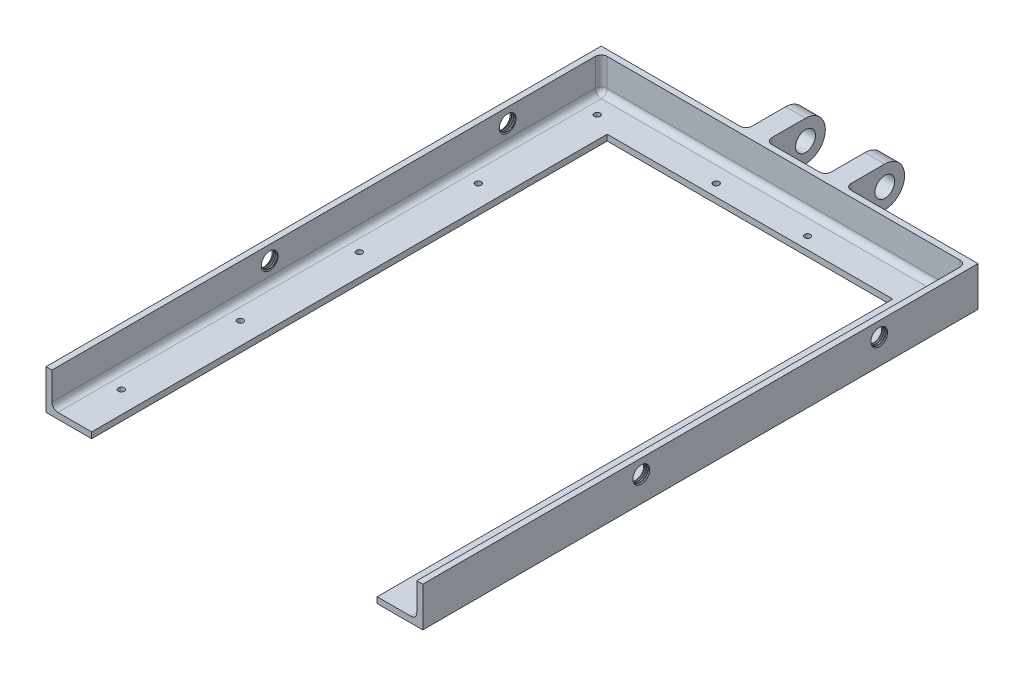
from build123d import *

# Parameters (mm, degrees)
SKETCH1_W               = 196
SKETCH1_H               = 20
BOSS_EXTRUDE1_DEPTH     = 3
SKETCH2_W               = 196
SKETCH2_H               = 3
BOSS_EXTRUDE2_DEPTH     = 17
FILLET1_R               = 3
SKETCH4_W               = 10
SKETCH4_H               = 20
BOSS_EXTRUDE3_DEPTH     = 30
FILLET2_R               = 10
CUT_EXTRUDE2_DEPTH      = 122.527774603
CUT_EXTRUDE2_DEPTH_BACK = 122.527774603
SKETCH5_R               = 5
BOSS_EXTRUDE4_START     = -17
BOSS_EXTRUDE4_DEPTH     = 277
BOSS_EXTRUDE5_START     = -17
BOSS_EXTRUDE5_DEPTH     = 277
SKETCH8_W               = 6
SKETCH8_H               = 26.142530345
CUT_EXTRUDE3_DEPTH      = 30
SKETCH9_R               = 1.5
CUT_EXTRUDE4_DEPTH      = 288.737727801
FILLET4_R               = 3
CUT_EXTRUDE5_REACH      = 332.757
SKETCH10_R              = 4
THREAD1_PITCH           = 1
THREAD2_PITCH           = 1
THREAD3_PITCH           = 1
THREAD4_PITCH           = 1
FILLET7_R               = 3


with BuildPart() as part:
    # Sketch1 → Boss-Extrude1 (new body)
    with BuildSketch(Plane(origin=(0, 0, 0), x_dir=(1, 0, 0), z_dir=(0, 1, 0))):
        Rectangle(SKETCH1_W, SKETCH1_H)
    extrude(amount=BOSS_EXTRUDE1_DEPTH)

    # Sketch2 → Boss-Extrude2 (add)
    with BuildSketch(Plane(origin=(0, 3, 0), x_dir=(1, 0, 0), z_dir=(0, 1, 0))):
        with Locations((0, 8.5)):
            Rectangle(SKETCH2_W, SKETCH2_H)
    extrude(amount=BOSS_EXTRUDE2_DEPTH)

    # Fillet1
    fillet1_edges = [part.edges().sort_by_distance(p)[0] for p in [
        (0, 3, -7),
    ]]
    fillet(fillet1_edges, radius=FILLET1_R)

    # Sketch4 → Boss-Extrude3 (add)
    with BuildSketch(Plane(origin=(0, 0, -10), x_dir=(-1, 0, 0), z_dir=(0, 0, -1))):
        with Locations((-20, 10)):
            Rectangle(SKETCH4_W, SKETCH4_H)
        with Locations((20, 10)):
            Rectangle(SKETCH4_W, SKETCH4_H)
    extrude(amount=BOSS_EXTRUDE3_DEPTH)

    # Fillet2
    fillet2_edges = [part.edges().sort_by_distance(p)[0] for p in [
        (-20, 0, -40),
        (-20, 20, -40),
        (20, 0, -40),
        (20, 20, -40),
    ]]
    fillet(fillet2_edges, radius=FILLET2_R - 0.0001)  # a hair under: the kernel refuses the full size

    # Sketch5 → Cut-Extrude2 (cut, two sides: drawn at the far end of the back side and taken through both)
    with BuildSketch(Plane.ZY.offset(-15).offset(-CUT_EXTRUDE2_DEPTH_BACK)):
        with Locations(Location((-30, 10, 0), (0, 0, 270))):
            Circle(SKETCH5_R)
    extrude(amount=CUT_EXTRUDE2_DEPTH + CUT_EXTRUDE2_DEPTH_BACK, mode=Mode.SUBTRACT)

    # Sketch6 → Boss-Extrude4 (add)
    with BuildSketch(Plane.XY.offset(10).offset(BOSS_EXTRUDE4_START)):
        Polygon((-98, 0), (-75, 0), (-75, 3), (-95, 3), (-95, 20), (-98, 20), align=None)
    extrude(amount=BOSS_EXTRUDE4_DEPTH)

    # Sketch7 → Boss-Extrude5 (add)
    with BuildSketch(Plane.XY.offset(10).offset(BOSS_EXTRUDE5_START)):
        Polygon((92, 0), (87, 0), (69, 0), (69, 3), (89, 3), (89, 20), (92, 20), align=None)
    extrude(amount=BOSS_EXTRUDE5_DEPTH)

    # Sketch8 → Cut-Extrude3 (cut)
    with BuildSketch(Plane.XY.offset(10)):
        with Locations((95, 13.071265173)):
            Rectangle(SKETCH8_W, SKETCH8_H)
    extrude(amount=-CUT_EXTRUDE3_DEPTH, mode=Mode.SUBTRACT)

    # Sketch9 → Cut-Extrude4 (cut, through all)
    with BuildSketch(Plane(origin=(0, 3, 0), x_dir=(1, 0, 0), z_dir=(0, 1, 0))):
        with Locations(Location((-86, -4, 0), (0, 0, 270))):
            Circle(SKETCH9_R)
        with Locations(Location((-26, -4, 0), (0, 0, 270))):
            Circle(SKETCH9_R)
        with Locations(Location((20, -4, 0), (0, 0, 270))):
            Circle(SKETCH9_R)
        with Locations(Location((80, -4, 0), (0, 0, 270))):
            Circle(SKETCH9_R)
        with Locations(Location((-86, -64, 0), (0, 0, 270))):
            Circle(SKETCH9_R)
        with Locations(Location((-86, -124, 0), (0, 0, 270))):
            Circle(SKETCH9_R)
        with Locations(Location((80, -64, 0), (0, 0, 270))):
            Circle(SKETCH9_R)
        with Locations(Location((80, -124, 0), (0, 0, 270))):
            Circle(SKETCH9_R)
        with Locations(Location((-86, -184, 0), (0, 0, 270))):
            Circle(SKETCH9_R)
        with Locations(Location((80, -184, 0), (0, 0, 270))):
            Circle(SKETCH9_R)
        with Locations(Location((-86, -244, 0), (0, 0, 270))):
            Circle(SKETCH9_R)
        with Locations(Location((80, -244, 0), (0, 0, 270))):
            Circle(SKETCH9_R)
    extrude(amount=-CUT_EXTRUDE4_DEPTH, mode=Mode.SUBTRACT)

    # Fillet4
    fillet4_edges = [part.edges().sort_by_distance(p)[0] for p in [
        (-95, 3.878679656, -6.121320344),
        (-95, 3, 133),
        (-95, 13, -7),
        (89, 3.878679656, -6.121320344),
        (89, 3, 133),
        (89, 13, -7),
    ]]
    fillet(fillet4_edges, radius=FILLET4_R)

    # Cut-Extrude5: up to this face of the body (flat: up to its plane)
    cut_extrude5_end = Plane(part.part.faces().sort_by_distance((92, 10, 130))[0])
    # Sketch10 → Cut-Extrude5 (cut, up to the picked face)
    with BuildSketch(Plane.ZY.offset(98), mode=Mode.PRIVATE) as cut_extrude5_sk1:
        with Locations((160, 13)):
            Circle(SKETCH10_R)
    cut_extrude5_tool1 = split(extrude(cut_extrude5_sk1.sketch, amount=-CUT_EXTRUDE5_REACH, mode=Mode.PRIVATE), bisect_by=cut_extrude5_end, keep=Keep.BOTH, mode=Mode.PRIVATE)
    # Sketch10 → Cut-Extrude5 (cut, up to the picked face)
    with BuildSketch(Plane.ZY.offset(98), mode=Mode.PRIVATE) as cut_extrude5_sk2:
        with Locations((40, 13)):
            Circle(SKETCH10_R)
    cut_extrude5_tool2 = split(extrude(cut_extrude5_sk2.sketch, amount=-CUT_EXTRUDE5_REACH, mode=Mode.PRIVATE), bisect_by=cut_extrude5_end, keep=Keep.BOTH, mode=Mode.PRIVATE)
    add(cut_extrude5_tool1.solids().sort_by(Axis((-98, 13, 160), (1, 0, 0)))[0], mode=Mode.SUBTRACT)
    add(cut_extrude5_tool2.solids().sort_by(Axis((-98, 13, 40), (1, 0, 0)))[0], mode=Mode.SUBTRACT)

    # Thread1: the profile of Thread Profile1 profile screwed along a right-hand helix of 10 turns, 8 arcs to a turn; built about Z, then put on its axis
    thread1_z = Axis((0, 0, 0), (0, 0, 1))
    thread1_corners = [(3.9997, 0, -0.000173205), (4.541265875, 0, 0.312499999), (4.541265875, 0, 0.437499999), (3.9997, 0, 0.750173202)]
    with BuildLine(mode=Mode.PRIVATE) as thread1_profile:
        Line(thread1_corners[0], thread1_corners[1])
        Line(thread1_corners[1], thread1_corners[2])
        Line(thread1_corners[2], thread1_corners[3])
        Line(thread1_corners[3], thread1_corners[0])
    thread1_cap = Face(thread1_profile.wire())
    thread1_turn_angles = [0, 22.5, 45, 67.5, 90, 112.5, 135, 157.5, 180, 202.5, 225, 247.5, 270, 292.5, 315, 337.5, 360]
    thread1_turn_weights = [1, 0.9238795325112867, 1, 0.9238795325112867, 1, 0.9238795325112867, 1, 0.9238795325112867, 1, 0.9238795325112867, 1, 0.9238795325112867, 1, 0.9238795325112867, 1, 0.9238795325112867, 1]
    thread1_turn_rails = [Edge.make_bspline([Vector(p[0], p[1], 0).rotate(thread1_z, thread1_turn_angles[k]) / thread1_turn_weights[k] + Vector(0, 0, p[2] + THREAD1_PITCH * thread1_turn_angles[k] / 360) for k in range(17)], [0, 0, 0, 1, 1, 2, 2, 3, 3, 4, 4, 5, 5, 6, 6, 7, 7, 8, 8, 8], 2, thread1_turn_weights) for p in thread1_corners]
    thread1_turn_sides = [Face.make_surface_from_curves(thread1_turn_rails[p[0]], thread1_turn_rails[p[1]]) for p in [(0, 1), (1, 2), (2, 3), (3, 0)]]
    thread1 = Plane(origin=(-99, 13, 40), x_dir=(0, 0, -1), z_dir=(1, 0, 0)) * Solid(Shell([*[p.moved(Location((0, 0, THREAD1_PITCH * i))) for i in range(10) for p in thread1_turn_sides], thread1_cap, thread1_cap.rotate(thread1_z, 3600).moved(Location((0, 0, THREAD1_PITCH * 3600 / 360)))]))
    add(thread1, mode=Mode.SUBTRACT)

    # Thread2: the profile of Thread Profile2 profile screwed along a right-hand helix of 10 turns, 8 arcs to a turn; built about Z, then put on its axis
    thread2_z = Axis((0, 0, 0), (0, 0, 1))
    thread2_corners = [(3.9997, 0, -0.000173205), (4.541265875, 0, 0.312499999), (4.541265875, 0, 0.437499999), (3.9997, 0, 0.750173202)]
    with BuildLine(mode=Mode.PRIVATE) as thread2_profile:
        Line(thread2_corners[0], thread2_corners[1])
        Line(thread2_corners[1], thread2_corners[2])
        Line(thread2_corners[2], thread2_corners[3])
        Line(thread2_corners[3], thread2_corners[0])
    thread2_cap = Face(thread2_profile.wire())
    thread2_turn_angles = [0, 22.5, 45, 67.5, 90, 112.5, 135, 157.5, 180, 202.5, 225, 247.5, 270, 292.5, 315, 337.5, 360]
    thread2_turn_weights = [1, 0.9238795325112867, 1, 0.9238795325112867, 1, 0.9238795325112867, 1, 0.9238795325112867, 1, 0.9238795325112867, 1, 0.9238795325112867, 1, 0.9238795325112867, 1, 0.9238795325112867, 1]
    thread2_turn_rails = [Edge.make_bspline([Vector(p[0], p[1], 0).rotate(thread2_z, thread2_turn_angles[k]) / thread2_turn_weights[k] + Vector(0, 0, p[2] + THREAD2_PITCH * thread2_turn_angles[k] / 360) for k in range(17)], [0, 0, 0, 1, 1, 2, 2, 3, 3, 4, 4, 5, 5, 6, 6, 7, 7, 8, 8, 8], 2, thread2_turn_weights) for p in thread2_corners]
    thread2_turn_sides = [Face.make_surface_from_curves(thread2_turn_rails[p[0]], thread2_turn_rails[p[1]]) for p in [(0, 1), (1, 2), (2, 3), (3, 0)]]
    thread2 = Plane(origin=(-99, 13, 160), x_dir=(0, 0, -1), z_dir=(1, 0, 0)) * Solid(Shell([*[p.moved(Location((0, 0, THREAD2_PITCH * i))) for i in range(10) for p in thread2_turn_sides], thread2_cap, thread2_cap.rotate(thread2_z, 3600).moved(Location((0, 0, THREAD2_PITCH * 3600 / 360)))]))
    add(thread2, mode=Mode.SUBTRACT)

    # Thread3: the profile of Thread Profile3 profile screwed along a right-hand helix of 10 turns, 8 arcs to a turn; built about Z, then put on its axis
    thread3_z = Axis((0, 0, 0), (0, 0, 1))
    thread3_corners = [(3.9997, 0, -0.000173205), (4.541265875, 0, 0.312499999), (4.541265875, 0, 0.437499999), (3.9997, 0, 0.750173202)]
    with BuildLine(mode=Mode.PRIVATE) as thread3_profile:
        Line(thread3_corners[0], thread3_corners[1])
        Line(thread3_corners[1], thread3_corners[2])
        Line(thread3_corners[2], thread3_corners[3])
        Line(thread3_corners[3], thread3_corners[0])
    thread3_cap = Face(thread3_profile.wire())
    thread3_turn_angles = [0, 22.5, 45, 67.5, 90, 112.5, 135, 157.5, 180, 202.5, 225, 247.5, 270, 292.5, 315, 337.5, 360]
    thread3_turn_weights = [1, 0.9238795325112867, 1, 0.9238795325112867, 1, 0.9238795325112867, 1, 0.9238795325112867, 1, 0.9238795325112867, 1, 0.9238795325112867, 1, 0.9238795325112867, 1, 0.9238795325112867, 1]
    thread3_turn_rails = [Edge.make_bspline([Vector(p[0], p[1], 0).rotate(thread3_z, thread3_turn_angles[k]) / thread3_turn_weights[k] + Vector(0, 0, p[2] + THREAD3_PITCH * thread3_turn_angles[k] / 360) for k in range(17)], [0, 0, 0, 1, 1, 2, 2, 3, 3, 4, 4, 5, 5, 6, 6, 7, 7, 8, 8, 8], 2, thread3_turn_weights) for p in thread3_corners]
    thread3_turn_sides = [Face.make_surface_from_curves(thread3_turn_rails[p[0]], thread3_turn_rails[p[1]]) for p in [(0, 1), (1, 2), (2, 3), (3, 0)]]
    thread3 = Plane(origin=(93, 13, 160), x_dir=(0, 0, 1), z_dir=(-1, 0, 0)) * Solid(Shell([*[p.moved(Location((0, 0, THREAD3_PITCH * i))) for i in range(10) for p in thread3_turn_sides], thread3_cap, thread3_cap.rotate(thread3_z, 3600).moved(Location((0, 0, THREAD3_PITCH * 3600 / 360)))]))
    add(thread3, mode=Mode.SUBTRACT)

    # Thread4: the profile of Thread Profile4 profile screwed along a right-hand helix of 10 turns, 8 arcs to a turn; built about Z, then put on its axis
    thread4_z = Axis((0, 0, 0), (0, 0, 1))
    thread4_corners = [(3.9997, 0, -0.000173205), (4.541265875, 0, 0.312499999), (4.541265875, 0, 0.437499999), (3.9997, 0, 0.750173202)]
    with BuildLine(mode=Mode.PRIVATE) as thread4_profile:
        Line(thread4_corners[0], thread4_corners[1])
        Line(thread4_corners[1], thread4_corners[2])
        Line(thread4_corners[2], thread4_corners[3])
        Line(thread4_corners[3], thread4_corners[0])
    thread4_cap = Face(thread4_profile.wire())
    thread4_turn_angles = [0, 22.5, 45, 67.5, 90, 112.5, 135, 157.5, 180, 202.5, 225, 247.5, 270, 292.5, 315, 337.5, 360]
    thread4_turn_weights = [1, 0.9238795325112867, 1, 0.9238795325112867, 1, 0.9238795325112867, 1, 0.9238795325112867, 1, 0.9238795325112867, 1, 0.9238795325112867, 1, 0.9238795325112867, 1, 0.9238795325112867, 1]
    thread4_turn_rails = [Edge.make_bspline([Vector(p[0], p[1], 0).rotate(thread4_z, thread4_turn_angles[k]) / thread4_turn_weights[k] + Vector(0, 0, p[2] + THREAD4_PITCH * thread4_turn_angles[k] / 360) for k in range(17)], [0, 0, 0, 1, 1, 2, 2, 3, 3, 4, 4, 5, 5, 6, 6, 7, 7, 8, 8, 8], 2, thread4_turn_weights) for p in thread4_corners]
    thread4_turn_sides = [Face.make_surface_from_curves(thread4_turn_rails[p[0]], thread4_turn_rails[p[1]]) for p in [(0, 1), (1, 2), (2, 3), (3, 0)]]
    thread4 = Plane(origin=(93, 13, 40), x_dir=(0, 0, 1), z_dir=(-1, 0, 0)) * Solid(Shell([*[p.moved(Location((0, 0, THREAD4_PITCH * i))) for i in range(10) for p in thread4_turn_sides], thread4_cap, thread4_cap.rotate(thread4_z, 3600).moved(Location((0, 0, THREAD4_PITCH * 3600 / 360)))]))
    add(thread4, mode=Mode.SUBTRACT)

    # Fillet7
    fillet7_edges = [part.edges().sort_by_distance(p)[0] for p in [
        (25, 10, -10),
        (15, 10, -10),
        (-15, 10, -10),
        (-25, 10, -10),
    ]]
    fillet(fillet7_edges, radius=FILLET7_R)


solid = part.part
